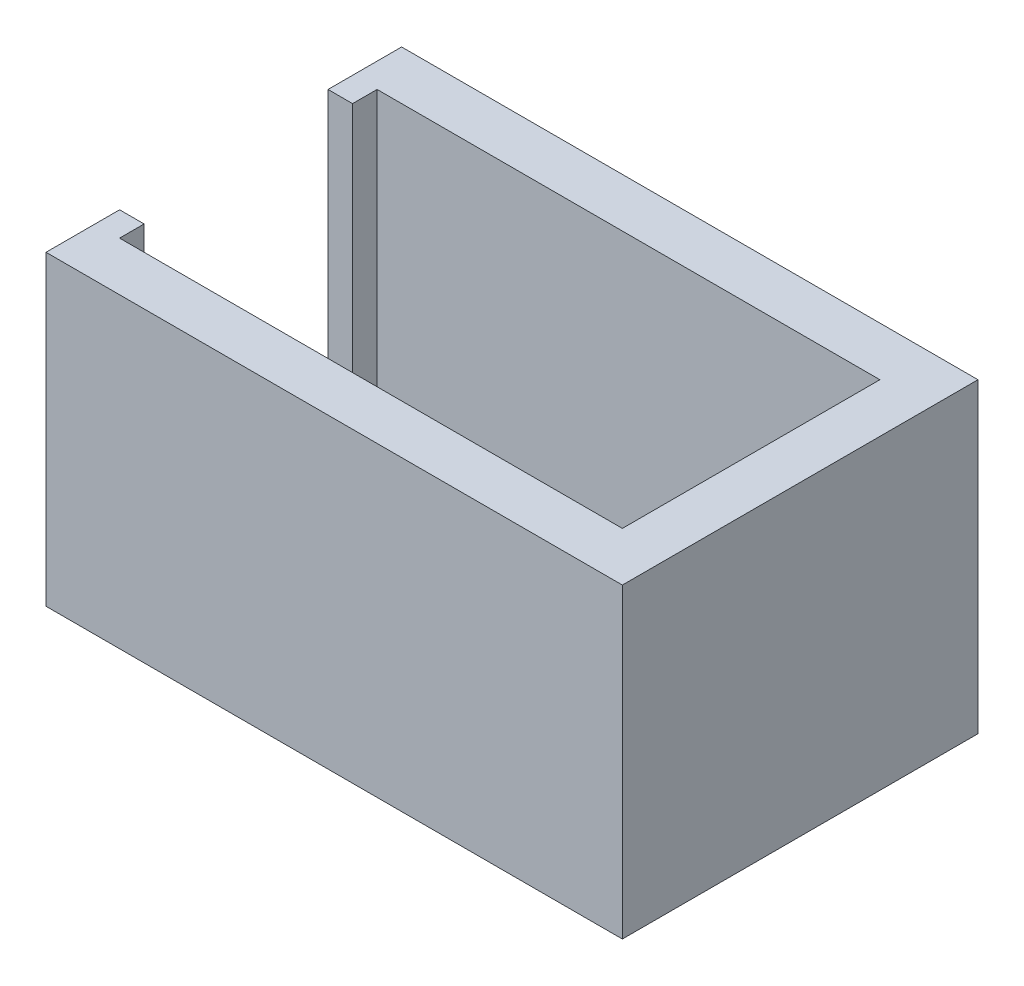
from build123d import *

# Parameters (mm, degrees)
BOSS_EXTRUDE1_DEPTH     = 26.67
SKETCH12_W              = 104.14
SKETCH12_H              = 36.83
BOSS_EXTRUDE2_DEPTH     = 5.08
CUT_EXTRUDE1_DEPTH      = 66.798380109
CUT_EXTRUDE1_DEPTH_BACK = 66.798380109
SKETCH14_W              = 44.45
SKETCH14_H              = 36.83


with BuildPart() as part:
    # Sketch1 → Boss-Extrude1 (new body)
    with BuildSketch(Plane(origin=(0, 0, 0), x_dir=(1, 0, 0), z_dir=(0, 1, 0))):
        Polygon((-49.53, 13.335), (-49.53, 18.415), (54.61, 18.415), (54.61, -18.415), (-49.53, -18.415), (-49.53, -13.335), (-5.08, -13.335), (-5.08, -10.79284188), (-2.54, -10.79284188), (-2.54, -13.335), (49.53, -13.335), (49.53, 13.335), (-2.54, 13.335), (-2.54, 10.79284188), (-5.08, 10.79284188), (-5.08, 13.335), align=None)
    extrude(amount=BOSS_EXTRUDE1_DEPTH)

    # Sketch12 → Boss-Extrude2 (add)
    with BuildSketch(Plane.XZ):
        with Locations((2.54, 0)):
            Rectangle(SKETCH12_W, SKETCH12_H)
    extrude(amount=BOSS_EXTRUDE2_DEPTH)

    # Sketch14 → Cut-Extrude1 (cut, two sides: drawn at the far end of the back side and taken through both)
    with BuildSketch(Plane(origin=(0, 26.67, 0), x_dir=(1, 0, 0), z_dir=(0, 1, 0)).offset(-CUT_EXTRUDE1_DEPTH_BACK)):
        with Locations((-27.305, 0)):
            Rectangle(SKETCH14_W, SKETCH14_H)
    extrude(amount=CUT_EXTRUDE1_DEPTH + CUT_EXTRUDE1_DEPTH_BACK, mode=Mode.SUBTRACT)


solid = part.part
